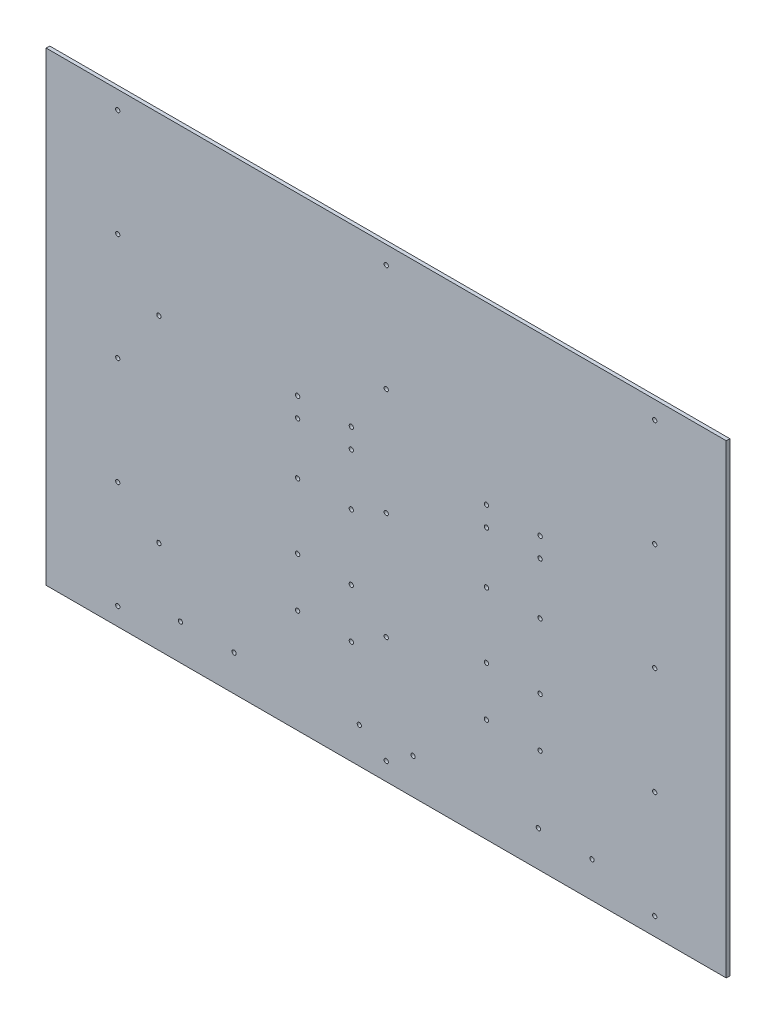
from build123d import *

# Parameters (mm, degrees)
SZKIC1_W                    = 1900
SZKIC1_H                    = 1300
DODANIE_WYCI_GNI_CIE1_DEPTH = 10
OTW_R_POD_RUB_M101_D        = 12
SZYK_LINIOWY1_COUNT         = 5
SZYK_LINIOWY1_PITCH         = 300
SZYK_LINIOWY1_COUNT_DIR2    = 3
SZYK_LINIOWY1_PITCH_DIR2    = 750
OTW_R_POD_RUB_M103_D        = 12
OTW_R_POD_RUB_M104_D        = 12
OTW_R_POD_RUB_M105_D        = 12
OTW_R_POD_RUB_M106_D        = 12


with BuildPart() as part:
    # Szkic1 → Dodanie-wyciągnięcie1 (new body)
    with BuildSketch(Plane.XY):
        Rectangle(SZKIC1_W, SZKIC1_H)
    extrude(amount=DODANIE_WYCI_GNI_CIE1_DEPTH)

    # Otwór pod śrubę M101 (through all)
    with Locations(Plane.XY.offset(10)):
        with Locations((-750, -600)):
            otw_r_pod_rub_m101 = Hole(OTW_R_POD_RUB_M101_D / 2)

    # Szyk liniowy1: Otw_r pod _rub_ M101 5 × 3
    with Locations(*[(j * SZYK_LINIOWY1_PITCH_DIR2, i * SZYK_LINIOWY1_PITCH, 0) for i in range(SZYK_LINIOWY1_COUNT) for j in range(SZYK_LINIOWY1_COUNT_DIR2) if (i, j) != (0, 0)]):
        add(otw_r_pod_rub_m101, mode=Mode.SUBTRACT)

    # Otwór pod śrubę M103 (through all)
    with Locations(Plane.XY.offset(10)):
        with Locations((-75, -550), (75, -550)):
            Hole(OTW_R_POD_RUB_M103_D / 2)

    # Otwór pod śrubę M104 (through all)
    with Locations(Plane.XY.offset(10)):
        with Locations((-575, -550), (-425, -550), (425, -550), (575, -550)):
            Hole(OTW_R_POD_RUB_M104_D / 2)

    # Otwór pod śrubę M105 (through all)
    with Locations(Plane.XY.offset(10)):
        with Locations((-635, -390), (-635, 160)):
            Hole(OTW_R_POD_RUB_M105_D / 2)

    # Otwór pod śrubę M106 (through all)
    with Locations(Plane.XY.offset(10)):
        with Locations((-247.5, -360), (-97.5, -360), (-97.5, -222.5), (-247.5, -222.5), (-97.5, -40), (-247.5, -40), (-247.5, 105), (-97.5, 105), (-97.5, 160), (-247.5, 160), (280, 160), (430, 160), (430, 105), (280, 105), (280, -40), (430, -40), (280, -222.5), (430, -222.5), (430, -360), (280, -360)):
            Hole(OTW_R_POD_RUB_M106_D / 2)


solid = part.part
